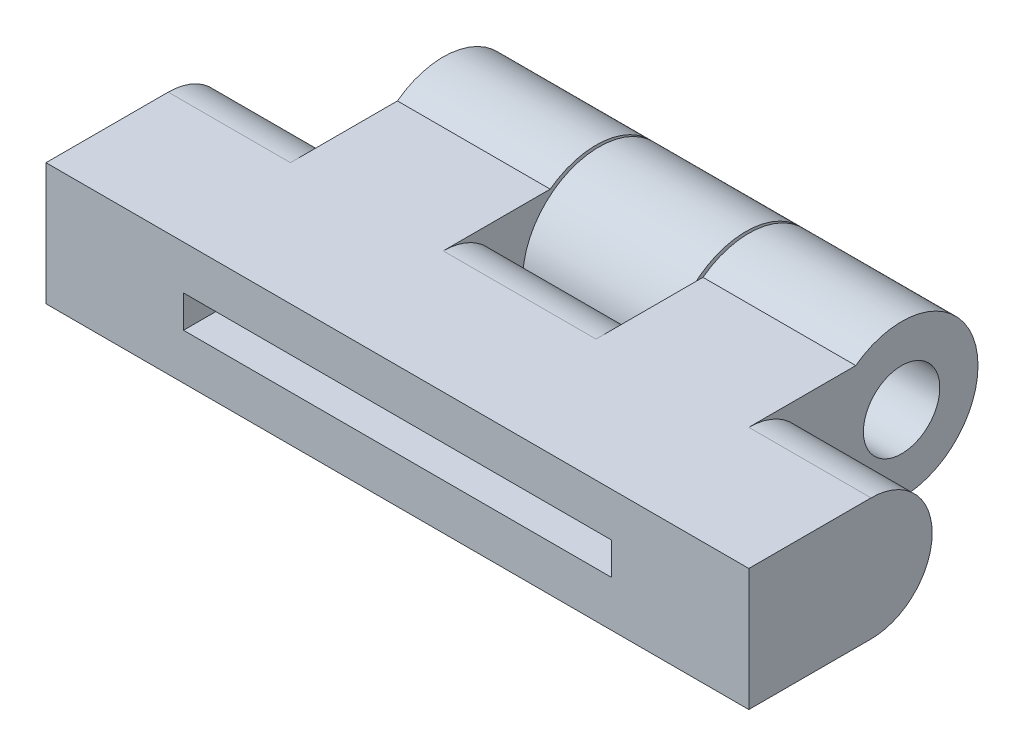
from build123d import *

# Parameters (mm, degrees)
SKETCH2_W            = 230
SKETCH2_H            = 40
BOSS_EXTRUDE1_DEPTH  = 80
SKETCH20_W           = 140
SKETCH20_H           = 10.587082732
CUT_EXTRUDE7_DEPTH   = 40
SKETCH6_R            = 25
BOSS_EXTRUDE3_DEPTH  = 50
SKETCH7_R            = 12.5
CUT_EXTRUDE2_DEPTH   = 50
SKETCH8_R            = 26.5
CUT_EXTRUDE3_DEPTH   = 25
CUT_EXTRUDE4_START   = 40
SKETCH11_R           = 26.5
CUT_EXTRUDE4_DEPTH   = 40
SKETCH14_W           = 12.614661349
SKETCH14_H           = 40
CUT_EXTRUDE6_DEPTH   = 50
FILLET3_R            = 20
FILLET3_OF_MIRROR5_R = 20
FILLET3_OF_MIRROR8_R = 20
SKETCH21_R           = 25
BOSS_EXTRUDE5_DEPTH  = 48
SKETCH22_R           = 12.5
CUT_EXTRUDE8_DEPTH   = 48


with BuildPart() as part:
    # Sketch2 → Boss-Extrude1 (new body)
    with BuildSketch(Plane.XY):
        with Locations((115, 20)):
            Rectangle(SKETCH2_W, SKETCH2_H)
    extrude(amount=BOSS_EXTRUDE1_DEPTH)

    # Sketch20 → Cut-Extrude7 (cut)
    with BuildSketch(Plane.XY.offset(80)):
        with Locations((115, 20.293541366)):
            Rectangle(SKETCH20_W, SKETCH20_H)
    extrude(amount=-CUT_EXTRUDE7_DEPTH, mode=Mode.SUBTRACT)

    # Sketch6 → Boss-Extrude3 (add)
    with BuildSketch(Plane(origin=(140, 0, 0), x_dir=(0, 0, -1), z_dir=(1, 0, 0))):
        with Locations((10, 20)):
            Circle(SKETCH6_R)
    boss_extrude3 = extrude(amount=BOSS_EXTRUDE3_DEPTH)

    # Sketch7 → Cut-Extrude2 (cut)
    with BuildSketch(Plane.ZY.offset(-140)):
        with Locations(Location((-10, 20, 0), (0, 0, 36.869897646))):
            Circle(SKETCH7_R)
    cut_extrude2 = extrude(amount=-CUT_EXTRUDE2_DEPTH, mode=Mode.SUBTRACT)

    # Sketch8 → Cut-Extrude3 (cut)
    with BuildSketch(Plane.ZY.offset(-140)):
        with Locations((-10, 20)):
            Circle(SKETCH8_R)
    cut_extrude3 = extrude(amount=CUT_EXTRUDE3_DEPTH, mode=Mode.SUBTRACT)

    # Sketch11 → Cut-Extrude4 (cut)
    with BuildSketch(Plane(origin=(190, 0, 0), x_dir=(0, 0, -1), z_dir=(1, 0, 0)).offset(CUT_EXTRUDE4_START)):
        with Locations((10, 20)):
            Circle(SKETCH11_R)
    cut_extrude4 = extrude(amount=-CUT_EXTRUDE4_DEPTH, mode=Mode.SUBTRACT)

    # Mirror1: Boss-Extrude3, Cut-Extrude2, Cut-Extrude3, Cut-Extrude4 across plane
    add(boss_extrude3.mirror(Plane(origin=(115, 0, 0), x_dir=(0, 0, 1), z_dir=(1, 0, 0))))
    add(cut_extrude2.mirror(Plane(origin=(115, 0, 0), x_dir=(0, 0, 1), z_dir=(1, 0, 0))), mode=Mode.SUBTRACT)
    add(cut_extrude3.mirror(Plane(origin=(115, 0, 0), x_dir=(0, 0, 1), z_dir=(1, 0, 0))), mode=Mode.SUBTRACT)
    add(cut_extrude4.mirror(Plane(origin=(115, 0, 0), x_dir=(0, 0, 1), z_dir=(1, 0, 0))), mode=Mode.SUBTRACT)

    # Sketch14 → Cut-Extrude6 (cut)
    with BuildSketch(Plane(origin=(90, 0, 0), x_dir=(0, 0, -1), z_dir=(1, 0, 0))):
        with Locations((-13.692669326, 20)):
            Rectangle(SKETCH14_W, SKETCH14_H)
    cut_extrude6 = extrude(amount=CUT_EXTRUDE6_DEPTH, mode=Mode.SUBTRACT)

    # Fillet3
    fillet3_edges = [part.edges().sort_by_distance(p)[0] for p in [
        (115, 40, 20),
        (115, 0, 20),
    ]]
    fillet(fillet3_edges, radius=FILLET3_R - 0.0001)  # a hair under: the kernel refuses the full size

    # Mirror5: Cut-Extrude6 across plane
    add(cut_extrude6.mirror(Plane.ZY.offset(-165)), mode=Mode.SUBTRACT)

    # Fillet3 of Mirror5
    fillet3_of_mirror5_edges = [part.edges().sort_by_distance(p)[0] for p in [
        (210, 40, 20),
        (210, 0, 20),
    ]]
    fillet(fillet3_of_mirror5_edges, radius=FILLET3_OF_MIRROR5_R - 0.0001)  # a hair under: the kernel refuses the full size

    # Mirror8: Cut-Extrude6 across plane
    add(cut_extrude6.mirror(Plane(origin=(65, 0, 0), x_dir=(0, 0, 1), z_dir=(1, 0, 0))), mode=Mode.SUBTRACT)

    # Fillet3 of Mirror8
    fillet3_of_mirror8_edges = [part.edges().sort_by_distance(p)[0] for p in [
        (20, 40, 20),
        (20, 0, 20),
    ]]
    fillet(fillet3_of_mirror8_edges, radius=FILLET3_OF_MIRROR8_R - 0.0001)  # a hair under: the kernel refuses the full size


with BuildPart() as body_2:
    # Sketch21 → Boss-Extrude5 (new body)
    with BuildSketch(Plane(origin=(91, 0, 0), x_dir=(0, 0, -1), z_dir=(1, 0, 0))):
        with Locations((10, 20)):
            Circle(SKETCH21_R)
    extrude(amount=BOSS_EXTRUDE5_DEPTH)

    # Sketch22 → Cut-Extrude8 (cut)
    with BuildSketch(Plane(origin=(91, 0, 0), x_dir=(0, 0, -1), z_dir=(1, 0, 0))):
        with Locations((10, 20)):
            Circle(SKETCH22_R)
    extrude(amount=CUT_EXTRUDE8_DEPTH, mode=Mode.SUBTRACT)


solid = Compound([part.part, body_2.part])
